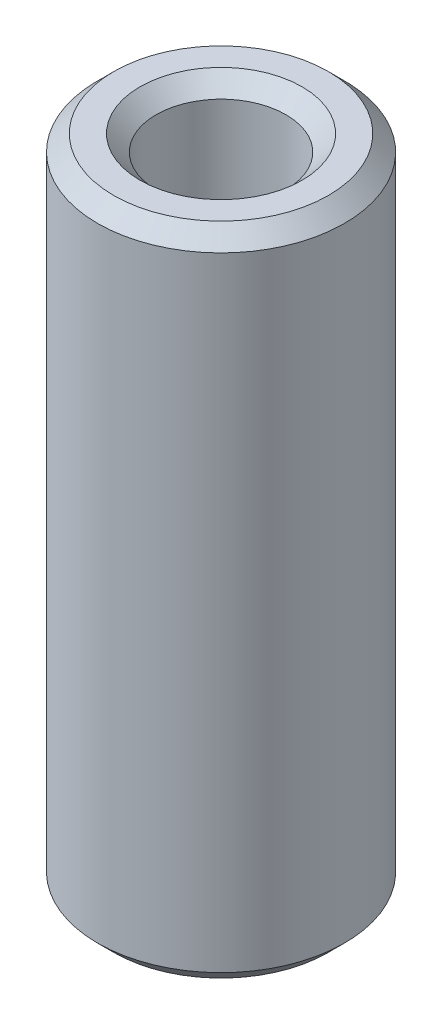
from build123d import *

# Parameters (mm, degrees)
SKETCH1_R           = 20
BOSS_EXTRUDE1_DEPTH = 106.196778002
SKETCH2_R           = 10.514144868
CUT_EXTRUDE1_DEPTH  = 110.898842842
CHAMFER1_SIZE       = 2.61229125


with BuildPart() as part:
    # Sketch1 → Boss-Extrude1 (new body)
    with BuildSketch(Plane(origin=(0, 0, 0), x_dir=(1, 0, 0), z_dir=(0, 1, 0))):
        Circle(SKETCH1_R)
    extrude(amount=BOSS_EXTRUDE1_DEPTH)

    # Sketch2 → Cut-Extrude1 (cut, through all)
    with BuildSketch(Plane(origin=(0, 0, 0), x_dir=(1, 0, 0), z_dir=(0, 1, 0))):
        Circle(SKETCH2_R)
    extrude(amount=CUT_EXTRUDE1_DEPTH, mode=Mode.SUBTRACT)

    # Chamfer1
    chamfer1_edges = [part.edges().sort_by_distance(p)[0] for p in [
        (-10.514144868, 106.196778002, 0),
        (-10.514144868, 0, 0),
        (-20, 0, 0),
        (-20, 106.196778002, 0),
    ]]
    chamfer(chamfer1_edges, length=CHAMFER1_SIZE)


solid = part.part
